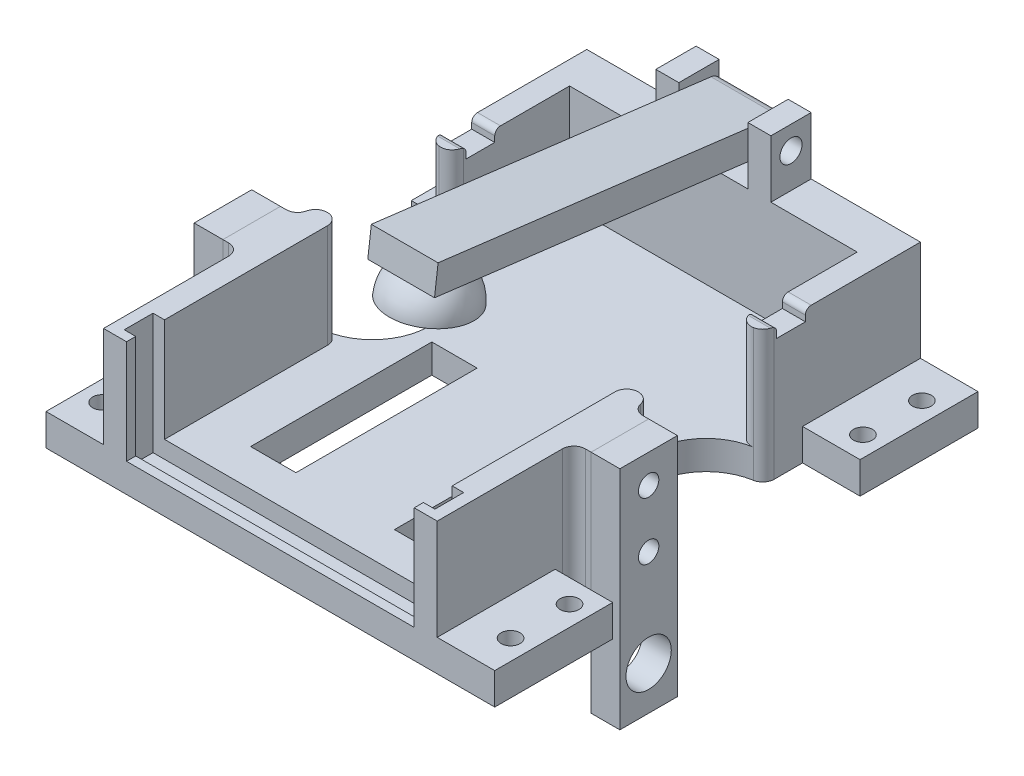
from build123d import *

# Parameters (mm, degrees)
SKETCH3_W                  = 63.5
SKETCH3_H                  = 88.9
BOSS_EXTRUDE1_DEPTH        = 2.54
BOSS_EXTRUDE2_DEPTH        = 25.4
SKETCH11_W                 = 25.4
SKETCH11_H                 = 5.08
BOSS_EXTRUDE10_DEPTH       = 12.7
SKETCH12_W                 = 15.24
SKETCH12_H                 = 5.08
CUT_EXTRUDE3_DEPTH         = 12.7
BOSS_EXTRUDE11_DEPTH       = 3.81
SKETCH13_R                 = 2.44475
CUT_EXTRUDE4_DEPTH         = 83.158301467
SKETCH5_W                  = 10
SKETCH5_H                  = 40
WHEEL_CUTOUTS_DEPTH        = 74.933200255
SKETCH7_W                  = 12.7
SKETCH7_H                  = 25.4
BOSS_EXTRUDE4_DEPTH        = 3.81
SKETCH8_W                  = 12.7
SKETCH8_H                  = 55.219
SKETCH8_R                  = 1.63195
SKETCH8_R_2                = 4.7625
BOSS_EXTRUDE5_DEPTH        = 6.35
FILLET1_R                  = 2.54
BOSS_EXTRUDE9_START        = -2.54
SKETCH9_W                  = 63.5
SKETCH9_H                  = 8.89
BOSS_EXTRUDE9_DEPTH        = 10.16
CUT_EXTRUDE2_REACH         = 116.989
SKETCH10_W                 = 63.5
SKETCH10_H                 = 0.5
SPLIT2_START               = -31.75
SPLIT2_OUTLINE_W           = 7.12
SPLIT2_OUTLINE_H           = 8.89
SPLIT2_DEPTH               = 63.5
SPLIT2_2_OUTLINE_W         = 7.12
SPLIT2_2_OUTLINE_H         = 8.89
SPLIT2_2_DEPTH             = 63.5
SKETCH15_R                 = 2.9718
HEATSERT_HOLES_DEPTH       = 5.4
EXTRA_LENGTH_DEPTH         = 3.81
SKETCH18_R                 = 2.9718
MOTOR_HEATSERT_HOLES_DEPTH = 5.4
SKETCH19_R                 = 2.2479
CUT_EXTRUDE6_DEPTH         = 110.433918417
SKETCH20_R                 = 2.0828
FEET_DEPTH                 = 3.175
SKETCH21_W                 = 12.7
SKETCH21_H                 = 49.920132824
SKETCH21_R                 = 4.99999
BOSS_EXTRUDE12_DEPTH       = 6.35
SPLIT4_START               = 40.64
SPLIT4_OUTLINE_W           = 49.920132824
SPLIT4_OUTLINE_H           = 12.7
SPLIT4_OUTLINE_R           = 4.99999
SPLIT4_DEPTH               = 6.35
SPLIT4_2_OUTLINE_W         = 49.920132824
SPLIT4_2_OUTLINE_H         = 12.7
SPLIT4_2_OUTLINE_R         = 4.99999
SPLIT4_2_DEPTH             = 6.35
THICKEN_START              = 3.81
SKETCH24_R                 = 2.0828
SKETCH24_W                 = 10
SKETCH24_H                 = 40
THICKEN_BASE_DEPTH         = 3.81
BOSS_EXTRUDE14_START       = 0.254
WEIGHT_MASTER_R            = 2.44475
BOSS_EXTRUDE14_DEPTH       = 14.732
FILLET3_R                  = 2.54
SKETCH27_W                 = 2.54
SKETCH27_H                 = 6.35
CUT_EXTRUDE7_DEPTH         = 22.86
SKETCH28_W                 = 68.58
SKETCH28_H                 = 6.35
CUT_EXTRUDE8_DEPTH         = 3.81
FINGER_HOLES_REACH         = 93.476
FILLET4_R                  = 2.54
SKETCH30_W                 = 73.66
SKETCH30_H                 = 6.35
CUT_EXTRUDE9_DEPTH         = 2.54
FILLET5_R                  = 1.27


# Read off the part's stored shape, not the designer's step: Split2, Split3, Split4
with BuildPart() as part:
    # Sketch3 → Boss-Extrude1 (new body)
    with BuildSketch(Plane(origin=(0, 0, 0), x_dir=(1, 0, 0), z_dir=(0, 1, 0))):
        Rectangle(SKETCH3_W, SKETCH3_H)
    extrude(amount=BOSS_EXTRUDE1_DEPTH)

    # Sketch4 → Boss-Extrude2 (add)
    with BuildSketch(Plane(origin=(0, 0, 0), x_dir=(1, 0, 0), z_dir=(0, 1, 0))):
        Polygon((-31.75, -44.45), (-31.75, 44.45), (31.75, 44.45), (31.75, -44.45), (31.75, -49.53), (36.83, -49.53), (36.83, 49.53), (-36.83, 49.53), (-36.83, -49.53), (-31.75, -49.53), align=None)
    extrude(amount=BOSS_EXTRUDE2_DEPTH)

    # Sketch11 → Boss-Extrude10 (add)
    with BuildSketch(Plane(origin=(0, 25.4, 0), x_dir=(1, 0, 0), z_dir=(0, 1, 0))):
        with Locations((0, 46.99)):
            Rectangle(SKETCH11_W, SKETCH11_H)
    extrude(amount=BOSS_EXTRUDE10_DEPTH)

    # Sketch12 → Cut-Extrude3 (cut)
    with BuildSketch(Plane(origin=(0, 38.1, 0), x_dir=(1, 0, 0), z_dir=(0, 1, 0))):
        with Locations((0, 46.99)):
            Rectangle(SKETCH12_W, SKETCH12_H)
    extrude(amount=-CUT_EXTRUDE3_DEPTH, mode=Mode.SUBTRACT)

    # Sketch14 → Boss-Extrude11 (add)
    with BuildSketch(Plane(origin=(0, 0, -49.53), x_dir=(-1, 0, 0), z_dir=(0, 0, -1))):
        Polygon((12.7, 38.1), (7.62, 38.1), (7.62, 25.4), (-7.62, 25.4), (-7.62, 38.1), (-12.7, 38.1), (-12.7, 25.4), (-36.83, 25.4), (-36.83, 0), (36.83, 0), (36.83, 25.4), (12.7, 25.4), align=None)
    extrude(amount=BOSS_EXTRUDE11_DEPTH)

    # Sketch13 → Cut-Extrude4 (cut, through all)
    with BuildSketch(Plane.ZY.offset(12.7)):
        with Locations((-48.895, 33.02)):
            Circle(SKETCH13_R)
    extrude(amount=-CUT_EXTRUDE4_DEPTH, mode=Mode.SUBTRACT)

    # Sketch5 → Wheel Cutouts (cut, through all)
    with BuildSketch(Plane(origin=(0, 2.54, 0), x_dir=(1, 0, 0), z_dir=(0, 1, 0))):
        with Locations((15.875, -16.825)):
            Rectangle(SKETCH5_W, SKETCH5_H)
        with Locations((-15.875, -16.825)):
            Rectangle(SKETCH5_W, SKETCH5_H)
    extrude(amount=-WHEEL_CUTOUTS_DEPTH, mode=Mode.SUBTRACT)

    # Sketch7 → Boss-Extrude4 (add)
    with BuildSketch(Plane.ZY.offset(36.83)):
        with Locations((16.825, 12.7)):
            Rectangle(SKETCH7_W, SKETCH7_H)
    boss_extrude4 = extrude(amount=BOSS_EXTRUDE4_DEPTH)

    # Sketch8 → Boss-Extrude5 (add)
    with BuildSketch(Plane.ZY.offset(40.64)):
        with Locations((16.825, -2.2095)):
            Rectangle(SKETCH8_W, SKETCH8_H)
        with Locations((16.825, -23.469)):
            Circle(SKETCH8_R, mode=Mode.SUBTRACT)
        with Locations((16.825, -6.451)):
            Circle(SKETCH8_R, mode=Mode.SUBTRACT)
        with Locations((16.825, -14.96)):
            Circle(SKETCH8_R_2, mode=Mode.SUBTRACT)
    extrude(amount=BOSS_EXTRUDE5_DEPTH)

    # Mirror12: Boss-Extrude4 across plane
    add(boss_extrude4.mirror(Plane(origin=(0, 0, 0), x_dir=(0, 0, 1), z_dir=(1, 0, 0))))

    # Fillet1
    fillet1_edges = [part.edges().sort_by_distance(p)[0] for p in [
        (-36.83, 12.7, 10.475),
        (-36.83, 12.7, 23.175),
        (36.83, 12.7, 10.475),
        (36.83, 12.7, 23.175),
    ]]
    fillet(fillet1_edges, radius=FILLET1_R)

    # Sketch9 → Boss-Extrude9 (add)
    with BuildSketch(Plane(origin=(0, 2.54, 0), x_dir=(1, 0, 0), z_dir=(0, 1, 0)).offset(BOSS_EXTRUDE9_START)):
        with Locations((0, -48.895)):
            Rectangle(SKETCH9_W, SKETCH9_H)
    extrude(amount=BOSS_EXTRUDE9_DEPTH)

    # Cut-Extrude2: up to this face of the body (flat: up to its plane)
    cut_extrude2_end = Plane(part.part.faces().sort_by_distance((0, 5.08, 53.34))[0])
    # Sketch10 → Cut-Extrude2 (cut, up to the picked face)
    with BuildSketch(Plane(origin=(0, 0, 44.45), x_dir=(-1, 0, 0), z_dir=(0, 0, -1)), mode=Mode.PRIVATE) as cut_extrude2_sk1:
        with Locations((0, 2.79)):
            Rectangle(SKETCH10_W, SKETCH10_H)
    cut_extrude2_tool1 = split(extrude(cut_extrude2_sk1.sketch, amount=-CUT_EXTRUDE2_REACH, mode=Mode.PRIVATE), bisect_by=cut_extrude2_end, keep=Keep.BOTH, mode=Mode.PRIVATE)
    add(cut_extrude2_tool1.solids().sort_by(Axis((0, 2.79, 44.45), (0, 0, 1)))[0], mode=Mode.SUBTRACT)

    # Split2 outline → Split2 (cut)
    with BuildSketch(Plane.YZ.offset(SPLIT2_START)):
        with Locations((6.6, 48.895)):
            Rectangle(SPLIT2_OUTLINE_W, SPLIT2_OUTLINE_H)
    extrude(amount=SPLIT2_DEPTH, mode=Mode.SUBTRACT)

    # Sketch16 → Extra Length (add)
    with BuildSketch(Plane.XY.offset(49.53)):
        Polygon((-36.83, 0), (-31.75, 0), (-31.75, 2.54), (-31.75, 25.4), (-36.83, 25.4), align=None)
        Polygon((31.75, 0), (36.83, 0), (36.83, 25.4), (31.75, 25.4), (31.75, 2.54), align=None)
    extrude(amount=EXTRA_LENGTH_DEPTH)


with BuildPart() as body_2:
    # Split2 2 outline → Split2 2 (new body)
    with BuildSketch(Plane.YZ.offset(SPLIT2_START)):
        with Locations((6.6, 48.895)):
            Rectangle(SPLIT2_2_OUTLINE_W, SPLIT2_2_OUTLINE_H)
    extrude(amount=SPLIT2_2_DEPTH)

    # Sketch15 → Heatsert Holes (cut)
    with BuildSketch(Plane(origin=(31.75, 0, 0), x_dir=(0, 0, -1), z_dir=(1, 0, 0))):
        with Locations((-48.895, 6.6)):
            Circle(SKETCH15_R)
    heatsert_holes = extrude(amount=-HEATSERT_HOLES_DEPTH, mode=Mode.SUBTRACT)

    # Mirror1: Heatsert Holes across plane
    add(heatsert_holes.mirror(Plane(origin=(0, 0, 0), x_dir=(0, 0, 1), z_dir=(1, 0, 0))), mode=Mode.SUBTRACT)


with BuildPart() as body_3:
    # Split3: the piece on the far side of the plane
    add(part.part)
    split(bisect_by=Plane.YZ.offset(-40.64), keep=Keep.BOTTOM)

    # Sketch19 → Cut-Extrude6 (cut, through all)
    with BuildSketch(Plane.ZY.offset(46.99)):
        with Locations((16.825, 19.05)):
            Circle(SKETCH19_R)
        with Locations((16.825, 6.35)):
            Circle(SKETCH19_R)
    cut_extrude6 = extrude(amount=-CUT_EXTRUDE6_DEPTH, mode=Mode.SUBTRACT)


with BuildPart() as part_1:
    add(part.part)

    # Split3
    split(bisect_by=Plane.YZ.offset(-40.64), keep=Keep.TOP)

    # Sketch18 → Motor Heatsert Holes (cut)
    with BuildSketch(Plane.ZY.offset(40.64)):
        with Locations((16.825, 19.05)):
            Circle(SKETCH18_R)
        with Locations((16.825, 6.35)):
            Circle(SKETCH18_R)
    motor_heatsert_holes = extrude(amount=-MOTOR_HEATSERT_HOLES_DEPTH, mode=Mode.SUBTRACT)

    # Mirror13: Motor Heatsert Holes across plane
    add(motor_heatsert_holes.mirror(Plane(origin=(0, 0, 0), x_dir=(0, 0, 1), z_dir=(1, 0, 0))), mode=Mode.SUBTRACT)

    # Sketch20 → Feet (add)
    # profile 1 of 4: a face of its own
    with BuildSketch(Plane.XZ):
        Polygon((-36.83, 53.34), (-49.53, 53.34), (-49.53, 37.465), (-49.53, 27.305), (-36.83, 27.305), (-36.83, 37.465), align=None)
        with Locations(Location((-45.085, 45.4025, 0), (0, 0, 270))):
            Circle(SKETCH20_R, mode=Mode.SUBTRACT)
        with Locations(Location((-45.085, 32.385, 0), (0, 0, 270))):
            Circle(SKETCH20_R, mode=Mode.SUBTRACT)
    # profile 2 of 4: a face of its own
    with BuildSketch(Plane.XZ):
        Polygon((-36.83, -37.465), (-36.83, -53.34), (-49.53, -53.34), (-49.53, -37.465), (-49.53, -27.305), (-36.83, -27.305), align=None)
        with Locations(Location((-45.085, -45.4025, 0), (0, 0, 270))):
            Circle(SKETCH20_R, mode=Mode.SUBTRACT)
        with Locations(Location((-45.085, -32.385, 0), (0, 0, 90))):
            Circle(SKETCH20_R, mode=Mode.SUBTRACT)
    # profile 3 of 4: a face of its own
    with BuildSketch(Plane.XZ):
        Polygon((49.53, -37.465), (49.53, -53.34), (36.83, -53.34), (36.83, -37.465), (36.83, -27.305), (49.53, -27.305), align=None)
        with Locations(Location((45.085, -45.4025, 0), (0, 0, 90))):
            Circle(SKETCH20_R, mode=Mode.SUBTRACT)
        with Locations(Location((45.085, -32.385, 0), (0, 0, 270))):
            Circle(SKETCH20_R, mode=Mode.SUBTRACT)
    # profile 4 of 4: a face of its own
    with BuildSketch(Plane.XZ):
        Polygon((49.53, 53.34), (49.53, 37.465), (49.53, 27.305), (36.83, 27.305), (36.83, 37.465), (36.83, 53.34), align=None)
        with Locations(Location((45.085, 45.4025, 0), (0, 0, 90))):
            Circle(SKETCH20_R, mode=Mode.SUBTRACT)
        with Locations(Location((45.085, 32.385, 0), (0, 0, 90))):
            Circle(SKETCH20_R, mode=Mode.SUBTRACT)
    extrude(amount=-FEET_DEPTH)

    # Sketch21 → Boss-Extrude12 (add)
    with BuildSketch(Plane(origin=(40.64, 0, 0), x_dir=(0, 0, -1), z_dir=(1, 0, 0))):
        with Locations((-16.825, 0.439933588)):
            Rectangle(SKETCH21_W, SKETCH21_H)
        with Locations((-16.825, -14.96)):
            Circle(SKETCH21_R, mode=Mode.SUBTRACT)
    extrude(amount=BOSS_EXTRUDE12_DEPTH)

    # Split4 2 outline → Split4 2 (cut)
    with BuildSketch(Plane.YZ.offset(SPLIT4_START)):
        with Locations((0.439933588, 16.825)):
            Rectangle(SPLIT4_2_OUTLINE_W, SPLIT4_2_OUTLINE_H)
        with Locations((-14.96, 16.825)):
            Circle(SPLIT4_2_OUTLINE_R, mode=Mode.SUBTRACT)
    extrude(amount=SPLIT4_2_DEPTH, mode=Mode.SUBTRACT)

    # Sketch24 → Thicken Base (add)
    with BuildSketch(Plane.XZ.offset(THICKEN_START)):
        with BuildLine():
            Line((36.83, 27.305), (49.53, 27.305))
            Line((49.53, 27.305), (49.53, 53.34))
            Line((49.53, 53.34), (-49.53, 53.34))
            Line((-49.53, 53.34), (-49.53, 27.305))
            Line((-49.53, 27.305), (-36.83, 27.305))
            Line((-36.83, 27.305), (-36.83, 25.715))
            ThreePointArc((-36.83, 25.715), (-37.573948776, 23.918948776), (-39.37, 23.175))
            Line((-39.37, 23.175), (-40.64, 23.175))
            Line((-40.64, 23.175), (-40.64, 10.475))
            Line((-40.64, 10.475), (-39.37, 10.475))
            ThreePointArc((-39.37, 10.475), (-37.573948776, 9.731051224), (-36.83, 7.935))
            Line((-36.83, 7.935), (-36.83, -27.305))
            Line((-36.83, -27.305), (-49.53, -27.305))
            Line((-49.53, -27.305), (-49.53, -53.34))
            Line((-49.53, -53.34), (49.53, -53.34))
            Line((49.53, -53.34), (49.53, -27.305))
            Line((49.53, -27.305), (36.83, -27.305))
            Line((36.83, -27.305), (36.83, 7.935))
            ThreePointArc((36.83, 7.935), (37.573948776, 9.731051224), (39.37, 10.475))
            Line((39.37, 10.475), (40.64, 10.475))
            Line((40.64, 10.475), (40.64, 23.175))
            Line((40.64, 23.175), (39.37, 23.175))
            ThreePointArc((39.37, 23.175), (37.573948776, 23.918948776), (36.83, 25.715))
            Line((36.83, 25.715), (36.83, 27.305))
        make_face()
        with Locations(Location((45.085, -45.4025, 0), (0, 0, 270))):
            Circle(SKETCH24_R, mode=Mode.SUBTRACT)
        with Locations(Location((45.085, 45.4025, 0), (0, 0, 270))):
            Circle(SKETCH24_R, mode=Mode.SUBTRACT)
        with Locations(Location((-45.085, -45.4025, 0), (0, 0, 270))):
            Circle(SKETCH24_R, mode=Mode.SUBTRACT)
        with Locations(Location((-45.085, 45.4025, 0), (0, 0, 270))):
            Circle(SKETCH24_R, mode=Mode.SUBTRACT)
        with Locations(Location((45.085, 32.385, 0), (0, 0, 270))):
            Circle(SKETCH24_R, mode=Mode.SUBTRACT)
        with Locations(Location((45.085, -32.385, 0), (0, 0, 270))):
            Circle(SKETCH24_R, mode=Mode.SUBTRACT)
        with Locations(Location((-45.085, -32.385, 0), (0, 0, 270))):
            Circle(SKETCH24_R, mode=Mode.SUBTRACT)
        with Locations(Location((-45.085, 32.385, 0), (0, 0, 270))):
            Circle(SKETCH24_R, mode=Mode.SUBTRACT)
        with Locations((15.875, 16.825)):
            Rectangle(SKETCH24_W, SKETCH24_H, mode=Mode.SUBTRACT)
        with Locations((-15.875, 16.825)):
            Rectangle(SKETCH24_W, SKETCH24_H, mode=Mode.SUBTRACT)
    extrude(amount=-THICKEN_BASE_DEPTH)

    # Sketch27 → Cut-Extrude7 (cut)
    with BuildSketch(Plane(origin=(0, 25.4, 0), x_dir=(1, 0, 0), z_dir=(0, 1, 0))):
        with Locations((33.02, -48.133)):
            Rectangle(SKETCH27_W, SKETCH27_H)
        with Locations((-33.02, -48.133)):
            Rectangle(SKETCH27_W, SKETCH27_H)
    extrude(amount=-CUT_EXTRUDE7_DEPTH, mode=Mode.SUBTRACT)

    # Sketch28 → Cut-Extrude8 (cut)
    with BuildSketch(Plane(origin=(0, 2.54, 0), x_dir=(1, 0, 0), z_dir=(0, 1, 0))):
        with Locations((0, -48.133)):
            Rectangle(SKETCH28_W, SKETCH28_H)
    extrude(amount=-CUT_EXTRUDE8_DEPTH, mode=Mode.SUBTRACT)

    # Finger Holes: up to this face of the body (flat: up to its plane)
    finger_holes_end = Plane(part_1.part.faces().sort_by_distance((0, -3.81, -1.401805915))[0])
    # Sketch29 → Finger Holes (cut, up to the picked face)
    with BuildSketch(Plane(origin=(0, 25.4, 0), x_dir=(1, 0, 0), z_dir=(0, 1, 0)), mode=Mode.PRIVATE) as finger_holes_sk1:
        with BuildLine():
            Line((-49.53, 18.735), (-36.83, 18.735))
            ThreePointArc((-36.83, 18.735), (-24.13, 6.035), (-36.83, -6.665))
            Line((-36.83, -6.665), (-49.53, -6.665))
            ThreePointArc((-49.53, -6.665), (-62.23, 6.035), (-49.53, 18.735))
        make_face()
    finger_holes_tool1 = split(extrude(finger_holes_sk1.sketch, amount=-FINGER_HOLES_REACH, mode=Mode.PRIVATE), bisect_by=finger_holes_end, keep=Keep.BOTH, mode=Mode.PRIVATE)
    # Sketch29 → Finger Holes (cut, up to the picked face)
    with BuildSketch(Plane(origin=(0, 25.4, 0), x_dir=(1, 0, 0), z_dir=(0, 1, 0)), mode=Mode.PRIVATE) as finger_holes_sk2:
        with BuildLine():
            Line((49.53, -6.665), (36.83, -6.665))
            ThreePointArc((36.83, -6.665), (24.13, 6.035), (36.83, 18.735))
            Line((36.83, 18.735), (49.53, 18.735))
            ThreePointArc((49.53, 18.735), (62.23, 6.035), (49.53, -6.665))
        make_face()
    finger_holes_tool2 = split(extrude(finger_holes_sk2.sketch, amount=-FINGER_HOLES_REACH, mode=Mode.PRIVATE), bisect_by=finger_holes_end, keep=Keep.BOTH, mode=Mode.PRIVATE)
    add(finger_holes_tool1.solids().sort_by(Axis((-43.18, 25.4, -6.035), (0, -1, 0)))[0], mode=Mode.SUBTRACT)
    add(finger_holes_tool2.solids().sort_by(Axis((43.18, 25.4, -6.035), (0, -1, 0)))[0], mode=Mode.SUBTRACT)

    # Fillet4
    fillet4_edges = [part_1.edges().sort_by_distance(p)[0] for p in [
        (-36.83, 10.795, 7.935),
        (36.83, 10.795, 7.935),
        (-31.75, 13.97, -17.674742265),
        (-31.75, 13.97, 5.604742265),
        (-36.83, 10.795, 6.665),
        (-36.83, 10.795, -18.735),
        (31.75, 13.97, -17.674742265),
        (36.83, 10.795, 6.665),
        (31.75, 13.97, 5.604742265),
        (36.83, 10.795, -18.735),
    ]]
    fillet(fillet4_edges, radius=FILLET4_R - 0.0001)  # a hair under: the kernel refuses the full size

    # Sketch30 → Cut-Extrude9 (cut)
    with BuildSketch(Plane(origin=(0, 25.4, 0), x_dir=(1, 0, 0), z_dir=(0, 1, 0))):
        with Locations((0, 24.765)):
            Rectangle(SKETCH30_W, SKETCH30_H)
    extrude(amount=-CUT_EXTRUDE9_DEPTH, mode=Mode.SUBTRACT)

    # Fillet5
    fillet5_edges = [part_1.edges().sort_by_distance(p)[0] for p in [
        (34.29, 25.4, -27.94),
        (34.29, 25.4, -21.59),
        (-34.29, 25.4, -27.94),
        (-34.29, 25.4, -21.59),
    ]]
    fillet(fillet5_edges, radius=FILLET5_R)


with BuildPart() as body_4:
    # Split4 outline → Split4 (new body)
    with BuildSketch(Plane.YZ.offset(SPLIT4_START)):
        with Locations((0.439933588, 16.825)):
            Rectangle(SPLIT4_OUTLINE_W, SPLIT4_OUTLINE_H)
        with Locations((-14.96, 16.825)):
            Circle(SPLIT4_OUTLINE_R, mode=Mode.SUBTRACT)
    extrude(amount=SPLIT4_DEPTH)

    # Mirror14: Cut-Extrude6 across plane
    add(cut_extrude6.mirror(Plane(origin=(0, 0, 0), x_dir=(0, 0, 1), z_dir=(1, 0, 0))), mode=Mode.SUBTRACT)


with BuildPart() as body_5:
    # Weight Master → Boss-Extrude14 (new body)
    # profile 1 of 3: a face of its own
    with BuildSketch(Plane.ZY.offset(-7.62).offset(BOSS_EXTRUDE14_START)):
        Polygon((23.68825442, 45.220569324), (-44.45, 36.770557879), (-44.45, 30.371915356), (24.469748867, 38.918842066), align=None)
    # profile 2 of 3: a face of its own
    with BuildSketch(Plane.ZY.offset(-7.62).offset(BOSS_EXTRUDE14_START)):
        Polygon((-53.34, 35.668084644), (-53.34, 31.713500198), (-53.041496402, 29.306460369), (-44.45, 30.371915356), (-44.45, 36.770557879), align=None)
        with Locations((-48.895, 33.02)):
            Circle(WEIGHT_MASTER_R, mode=Mode.SUBTRACT)
    # profile 3 of 3: a face of its own
    with BuildSketch(Plane.ZY.offset(-7.62).offset(BOSS_EXTRUDE14_START)):
        Polygon((-53.34, 35.668084644), (-53.822990849, 35.608187627), (-53.34, 31.713500198), align=None)
    extrude(amount=BOSS_EXTRUDE14_DEPTH)

    # Sketch26 → Revolve4 (revolve)
    with BuildSketch(Plane.ZY, mode=Mode.PRIVATE) as revolve4_sk:
        with BuildLine():
            Line((9.436682025, 30.655907774), (11.957372928, 30.968505553))
            ThreePointArc((11.957372928, 30.968505553), (13.250506086, 35.653394054), (17.477605739, 38.051727258))
            Line((17.477605739, 38.051727258), (17.16500796, 40.572418161))
            ThreePointArc((17.16500796, 40.572418161), (11.247068446, 37.214751676), (9.436682025, 30.655907774))
        make_face()
    revolve(revolve4_sk.sketch.rotate(Axis((0, 7.235617517, 21.299195861), (0, 0.9923979933261186, -0.12306999164009527)), 180), axis=Axis((0, 7.235617517, 21.299195861), (0, 0.9923979933261186, -0.12306999164009527)))

    # Fillet3
    fillet3_edges = [body_5.edges().sort_by_distance(p)[0] for p in [
        (0, 35.608187627, -53.822990849),
        (0, 29.306460369, -53.041496402),
    ]]
    fillet(fillet3_edges, radius=FILLET3_R)


solid = Compound([body_3.part, part_1.part, body_4.part, body_5.part])
